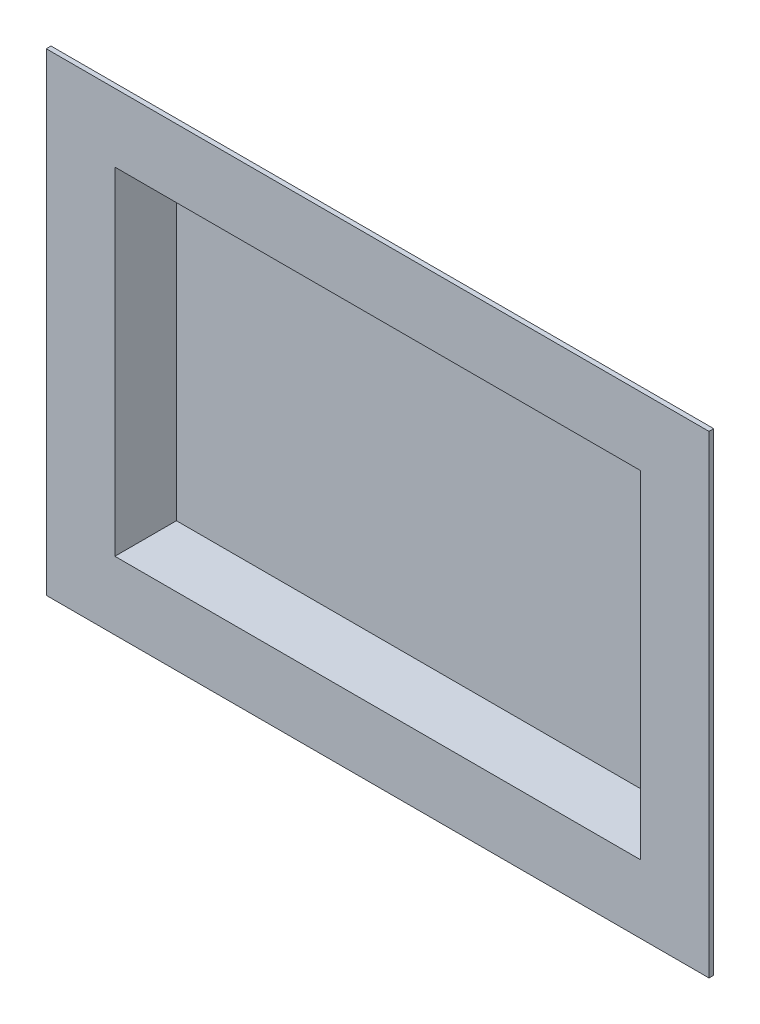
from build123d import *

# Parameters (mm, degrees)
SKETCH1_W           = 143.51
SKETCH1_H           = 92.964
BOSS_EXTRUDE1_DEPTH = 16.51
SKETCH2_W           = 177.8
SKETCH2_H           = 127
BOSS_EXTRUDE2_DEPTH = 1.27
SHELL1_START        = -70.485
SHELL1_OUTLINE_W    = 90.424
SHELL1_OUTLINE_H    = 16.51
SHELL1_DEPTH        = 140.97


# Read off the part's stored shape, not the designer's step: Shell1
with BuildPart() as part:
    # Sketch1 → Boss-Extrude1 (new body)
    with BuildSketch(Plane.XY):
        Rectangle(SKETCH1_W, SKETCH1_H)
    extrude(amount=-BOSS_EXTRUDE1_DEPTH)

    # Sketch2 → Boss-Extrude2 (add)
    with BuildSketch(Plane.XY):
        Rectangle(SKETCH2_W, SKETCH2_H)
    extrude(amount=BOSS_EXTRUDE2_DEPTH)

    # Shell1 outline → Shell1 (cut)
    with BuildSketch(Plane.YZ.offset(SHELL1_START)):
        with Locations((0, -6.985)):
            Rectangle(SHELL1_OUTLINE_W, SHELL1_OUTLINE_H)
    extrude(amount=SHELL1_DEPTH, mode=Mode.SUBTRACT)


solid = part.part
